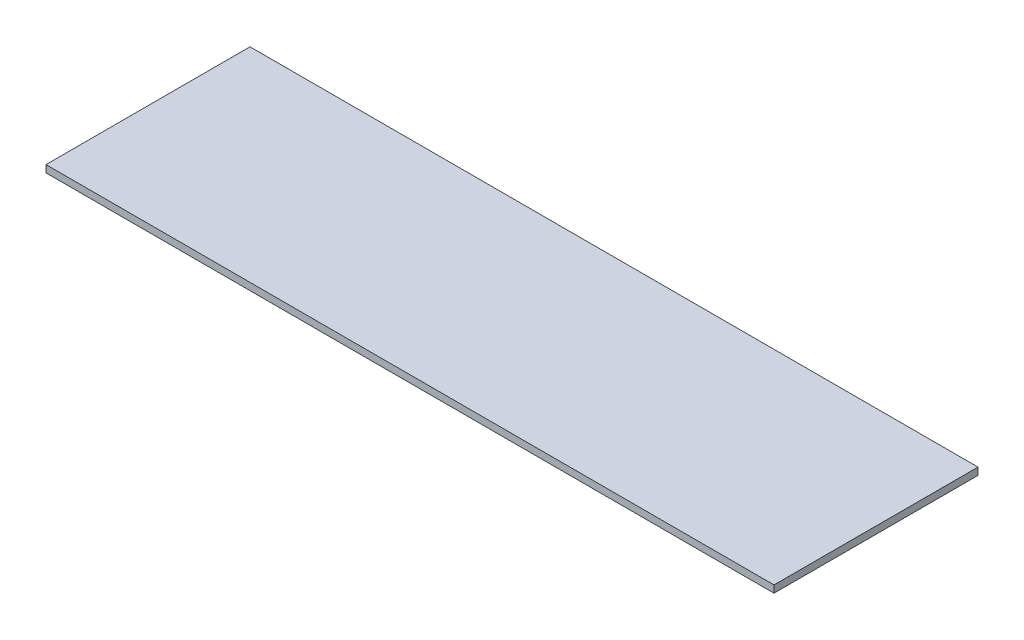
from build123d import *

# Parameters (mm, degrees)
SKETCH1_W           = 1820
SKETCH1_H           = 510
BOSS_EXTRUDE1_DEPTH = 18


with BuildPart() as part:
    # Sketch1 → Boss-Extrude1 (new body)
    with BuildSketch(Plane(origin=(0, 0, 0), x_dir=(1, 0, 0), z_dir=(0, 1, 0))):
        with Locations((910, 255)):
            Rectangle(SKETCH1_W, SKETCH1_H)
    extrude(amount=BOSS_EXTRUDE1_DEPTH)


solid = part.part
